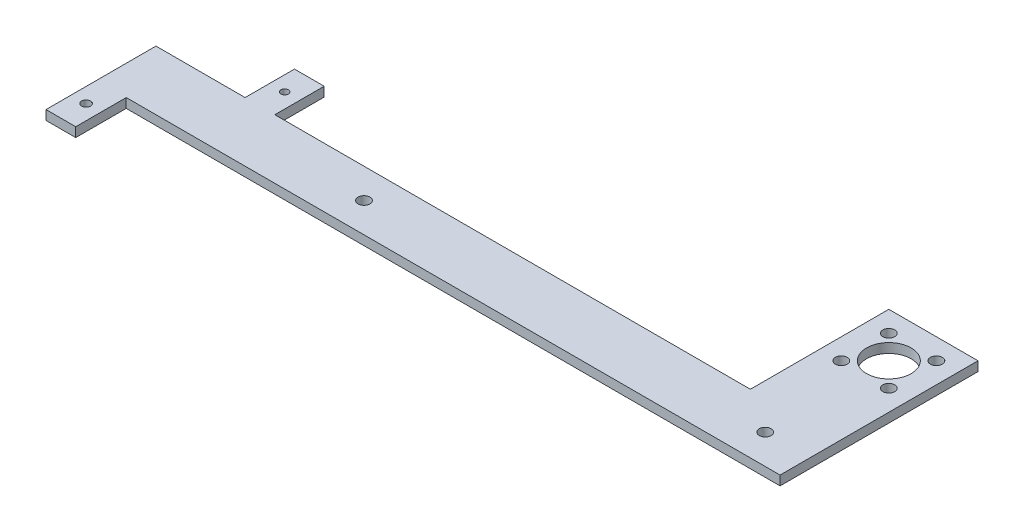
from build123d import *

# Parameters (mm, degrees)
SKETCH1_R           = 1.5
SKETCH1_R_2         = 1.25
SKETCH1_R_3         = 2
SKETCH1_R_4         = 7.5
BOSS_EXTRUDE1_DEPTH = 3.175


with BuildPart() as part:
    # Sketch1 → Boss-Extrude1 (new body)
    with BuildSketch(Plane(origin=(0, 0, 0), x_dir=(1, 0, 0), z_dir=(0, 1, 0))):
        Polygon((190, -36.6), (190, -26.6), (190, 30), (160, 30), (160, -16.6), (0, -16.6), (0, 0), (-10, 0), (-10, -16.6), (-40, -16.6), (-40, -53.6), (-30, -53.6), (-30, -36.6), align=None)
        with Locations((-35, -45.1)):
            Circle(SKETCH1_R, mode=Mode.SUBTRACT)
        with Locations((-5, -8.3)):
            Circle(SKETCH1_R_2, mode=Mode.SUBTRACT)
        with BuildLine():
            ThreePointArc((38, -26.6), (40, -24.6), (42, -26.6))
            ThreePointArc((42, -26.6), (40, -28.6), (38, -26.6))
        make_face(mode=Mode.SUBTRACT)
        with BuildLine():
            ThreePointArc((173, -26.6), (175, -24.6), (177, -26.6))
            ThreePointArc((177, -26.6), (175, -28.6), (173, -26.6))
        make_face(mode=Mode.SUBTRACT)
        with Locations((167, 23)):
            Circle(SKETCH1_R_3, mode=Mode.SUBTRACT)
        with Locations((167, 7)):
            Circle(SKETCH1_R_3, mode=Mode.SUBTRACT)
        with Locations((183, 7)):
            Circle(SKETCH1_R_3, mode=Mode.SUBTRACT)
        with Locations((183, 23)):
            Circle(SKETCH1_R_3, mode=Mode.SUBTRACT)
        with Locations((175, 15)):
            Circle(SKETCH1_R_4, mode=Mode.SUBTRACT)
    extrude(amount=BOSS_EXTRUDE1_DEPTH)


solid = part.part
